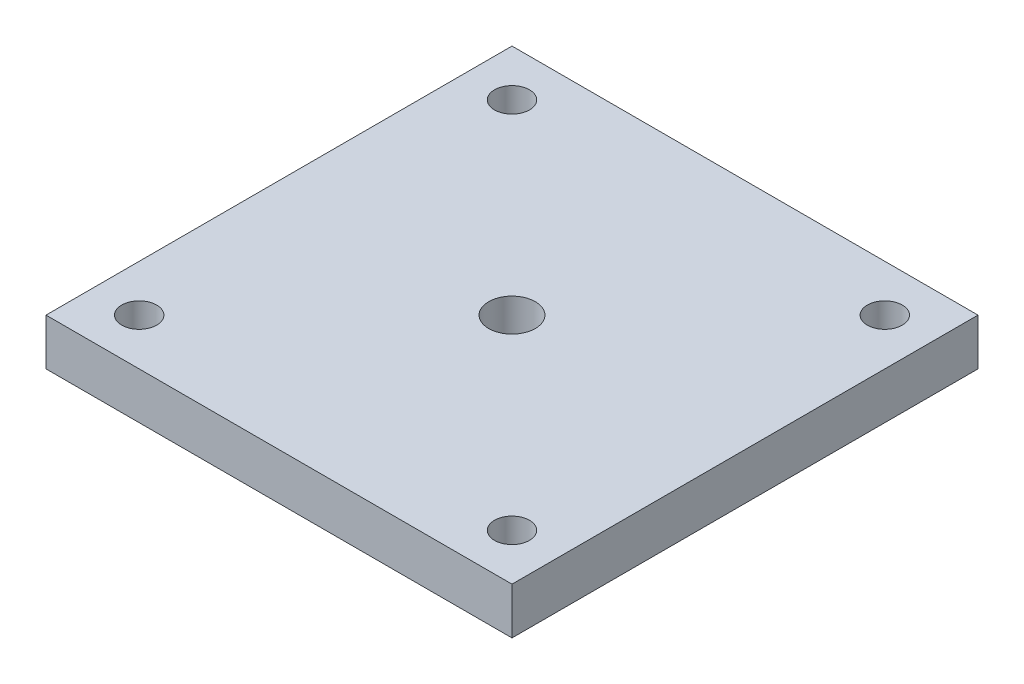
from build123d import *

# Parameters (mm, degrees)
SKETCH1_W           = 127
SKETCH1_H           = 127
SKETCH1_R           = 6.35
BOSS_EXTRUDE1_DEPTH = 12.7
SKETCH2_R           = 4.7625
CUT_EXTRUDE1_DEPTH  = 91.696141042


with BuildPart() as part:
    # Sketch1 → Boss-Extrude1 (new body)
    with BuildSketch(Plane(origin=(0, 0, 0), x_dir=(1, 0, 0), z_dir=(0, 1, 0))):
        Rectangle(SKETCH1_W, SKETCH1_H)
        Circle(SKETCH1_R, mode=Mode.SUBTRACT)
    extrude(amount=BOSS_EXTRUDE1_DEPTH)

    # Sketch2 → Cut-Extrude1 (cut, through all)
    with BuildSketch(Plane(origin=(0, 12.7, 0), x_dir=(1, 0, 0), z_dir=(0, 1, 0))):
        with Locations((-50.8, 50.8)):
            Circle(SKETCH2_R)
        with Locations((-50.8, -50.8)):
            Circle(SKETCH2_R)
        with Locations((50.8, -50.8)):
            Circle(SKETCH2_R)
        with Locations((50.8, 50.8)):
            Circle(SKETCH2_R)
    extrude(amount=-CUT_EXTRUDE1_DEPTH, mode=Mode.SUBTRACT)


solid = part.part
